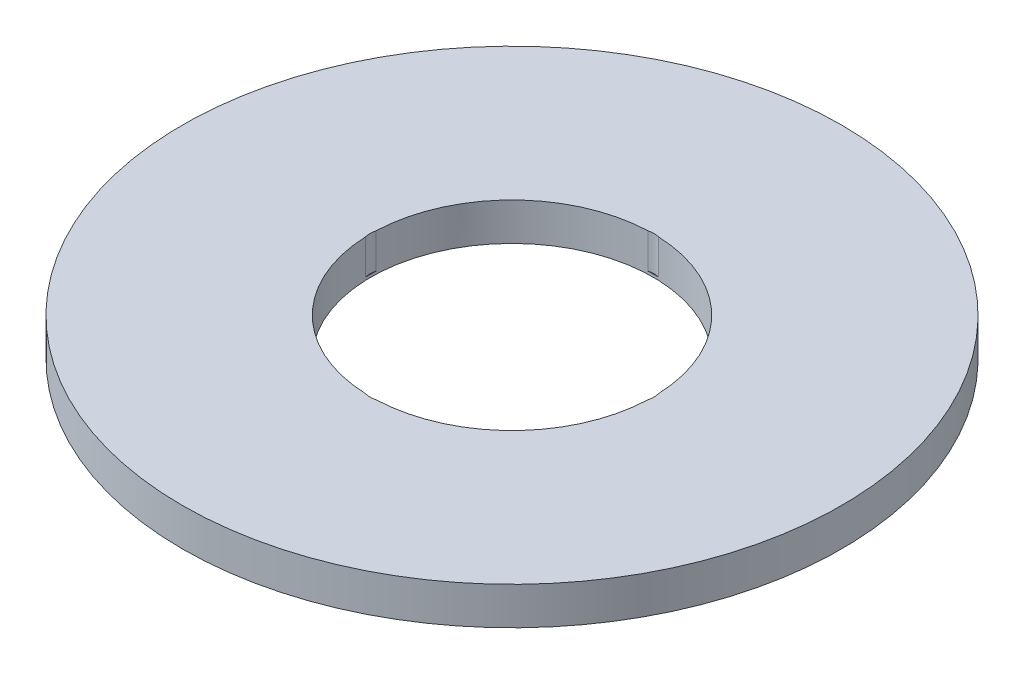
from build123d import *

# Parameters (mm, degrees)
SKETCH1_R           = 70
BOSS_EXTRUDE1_DEPTH = 8
SKETCH2_R           = 30
CUT_EXTRUDE1_DEPTH  = 100.317672143
SKETCH3_R           = 4.06595059
CUT_EXTRUDE2_DEPTH  = 7.420082287
CIRPATTERN1_COUNT   = 4


with BuildPart() as part:
    # Sketch1 → Boss-Extrude1 (new body)
    with BuildSketch(Plane(origin=(0, 0, 0), x_dir=(1, 0, 0), z_dir=(0, 1, 0))):
        Circle(SKETCH1_R)
    extrude(amount=BOSS_EXTRUDE1_DEPTH)

    # Sketch2 → Cut-Extrude1 (cut, through all)
    with BuildSketch(Plane(origin=(0, 0, 0), x_dir=(1, 0, 0), z_dir=(0, 1, 0))):
        Circle(SKETCH2_R)
    extrude(amount=CUT_EXTRUDE1_DEPTH, mode=Mode.SUBTRACT)

    # Sketch3 → Cut-Extrude2 (cut)
    with BuildSketch(Plane(origin=(0, 8, 0), x_dir=(1, 0, 0), z_dir=(0, 1, 0))):
        with Locations((-26.063919149, 0)):
            Circle(SKETCH3_R)
    cut_extrude2 = extrude(amount=-CUT_EXTRUDE2_DEPTH, mode=Mode.SUBTRACT)

    # CirPattern1: Cut-Extrude2 ×4 about axis
    cirpattern1_axis = Axis((0, 0, 0), (0, 1, 0))
    for i in range(1, CIRPATTERN1_COUNT):
        add(cut_extrude2.rotate(cirpattern1_axis, i * 360 / CIRPATTERN1_COUNT), mode=Mode.SUBTRACT)


solid = part.part
